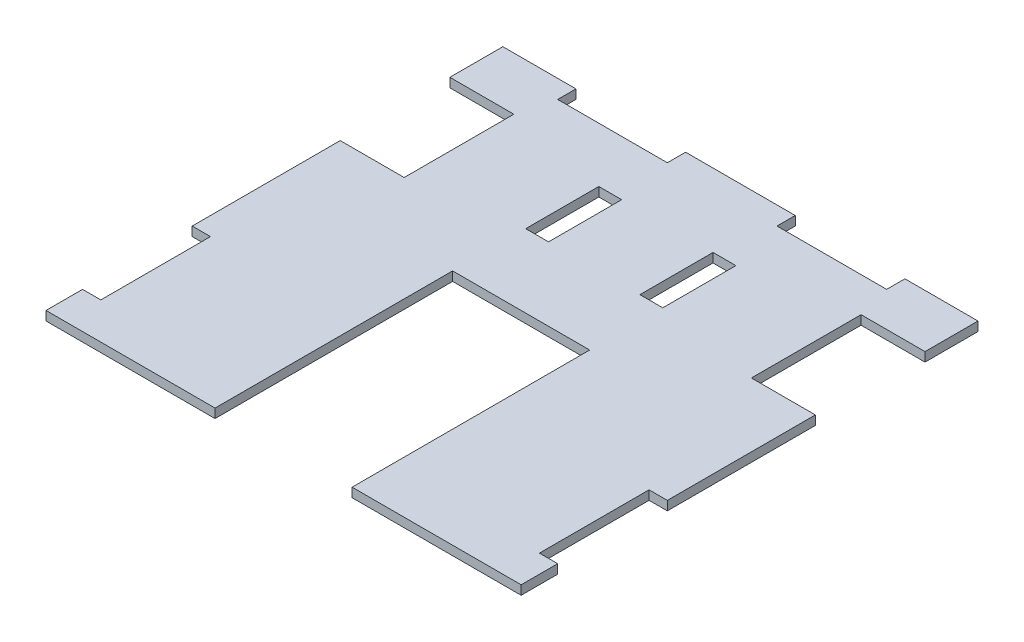
from build123d import *

# Parameters (mm, degrees)
BOSS_EXTRUDE1_DEPTH = 6.35
SKETCH2_W           = 44.45
SKETCH2_H           = 76.2
SKETCH2_W_2         = 12.7
SKETCH2_W_3         = 76.2
SKETCH2_H_2         = 12.7
CUT_EXTRUDE1_DEPTH  = 293.444905068
SKETCH3_W           = 15.875
SKETCH3_H           = 50.8
CUT_EXTRUDE2_DEPTH  = 293.444905068


with BuildPart() as part:
    # Sketch1 → Boss-Extrude1 (new body)
    with BuildSketch(Plane(origin=(0, 0, 0), x_dir=(1, 0, 0), z_dir=(0, 1, 0))):
        Polygon((-165.1, 76.2), (-165.1, -241.3), (-47.625, -241.3), (-47.625, -76.2), (47.625, -76.2), (47.625, -241.3), (165.1, -241.3), (165.1, 76.2), align=None)
    extrude(amount=BOSS_EXTRUDE1_DEPTH)

    # Sketch2 → Cut-Extrude1 (cut, through all)
    with BuildSketch(Plane(origin=(0, 6.35, 0), x_dir=(1, 0, 0), z_dir=(0, 1, 0))):
        with Locations((142.875, 1.27)):
            Rectangle(SKETCH2_W, SKETCH2_H)
        with Locations((158.75, -177.8)):
            Rectangle(SKETCH2_W_2, SKETCH2_H)
        with Locations((-158.75, -177.8)):
            Rectangle(SKETCH2_W_2, SKETCH2_H)
        with Locations((-142.875, 1.27)):
            Rectangle(SKETCH2_W, SKETCH2_H)
        with Locations((-76.2, 69.85)):
            Rectangle(SKETCH2_W_3, SKETCH2_H_2)
        with Locations((76.2, 69.85)):
            Rectangle(SKETCH2_W_3, SKETCH2_H_2)
    extrude(amount=-CUT_EXTRUDE1_DEPTH, mode=Mode.SUBTRACT)

    # Sketch3 → Cut-Extrude2 (cut, through all)
    with BuildSketch(Plane(origin=(0, 6.35, 0), x_dir=(1, 0, 0), z_dir=(0, 1, 0))):
        with Locations((-39.6875, 0)):
            Rectangle(SKETCH3_W, SKETCH3_H)
        with Locations((39.6875, 0)):
            Rectangle(SKETCH3_W, SKETCH3_H)
    extrude(amount=-CUT_EXTRUDE2_DEPTH, mode=Mode.SUBTRACT)


solid = part.part
